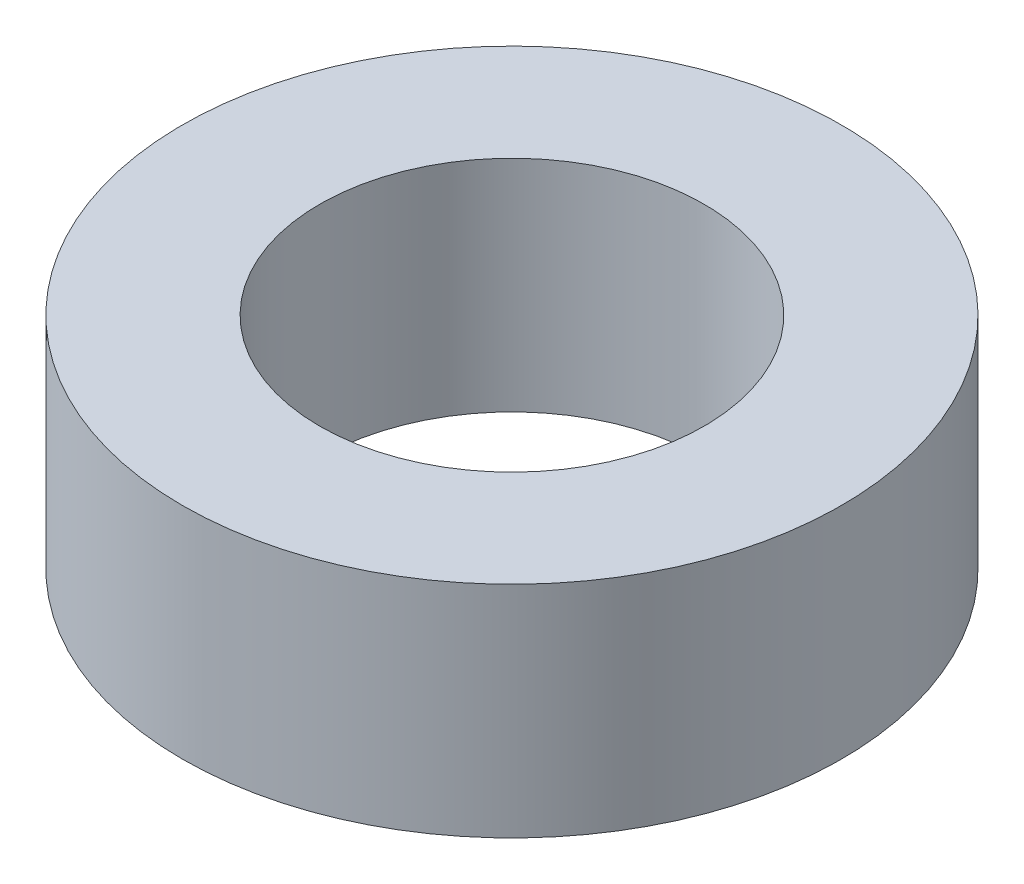
from build123d import *

# Parameters (mm, degrees)
SKETCH1_R           = 30
BOSS_EXTRUDE1_DEPTH = 20
SKETCH2_R           = 17.5
CUT_EXTRUDE1_DEPTH  = 47.904157598


with BuildPart() as part:
    # Sketch1 → Boss-Extrude1 (new body)
    with BuildSketch(Plane(origin=(0, 0, 0), x_dir=(1, 0, 0), z_dir=(0, 1, 0))):
        Circle(SKETCH1_R)
    extrude(amount=BOSS_EXTRUDE1_DEPTH)

    # Sketch2 → Cut-Extrude1 (cut, through all)
    with BuildSketch(Plane(origin=(0, 0, 0), x_dir=(1, 0, 0), z_dir=(0, 1, 0))):
        Circle(SKETCH2_R)
    extrude(amount=CUT_EXTRUDE1_DEPTH, mode=Mode.SUBTRACT)


solid = part.part
